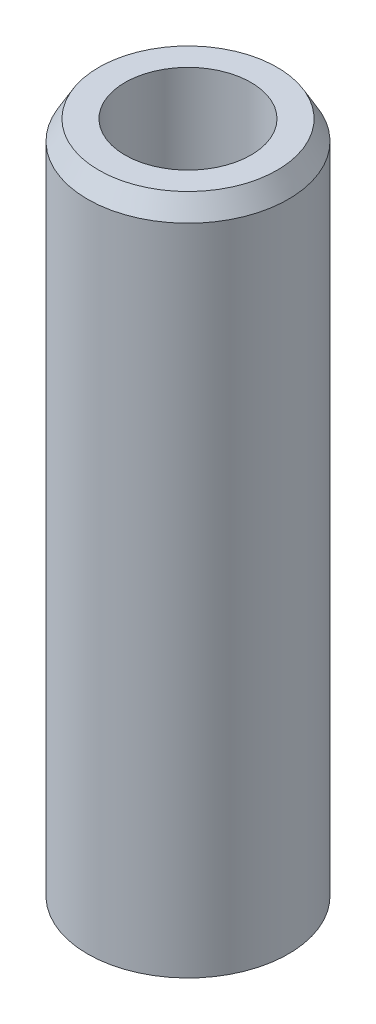
from build123d import *
from OCP.BRepFilletAPI import BRepFilletAPI_MakeChamfer

# Parameters (mm, degrees)
SKETCH1_R           = 7.5
BOSS_EXTRUDE1_DEPTH = 51.106512986
SKETCH2_R           = 4.702042441
CUT_EXTRUDE1_DEPTH  = 53.195552201
CHAMFER1_SIZE       = 1.456787229
CHAMFER1_SIZE2      = 0.841076499


with BuildPart() as part:
    # Sketch1 → Boss-Extrude1 (new body)
    with BuildSketch(Plane(origin=(0, 0, 0), x_dir=(1, 0, 0), z_dir=(0, 1, 0))):
        Circle(SKETCH1_R)
    extrude(amount=BOSS_EXTRUDE1_DEPTH)

    # Sketch2 → Cut-Extrude1 (cut, through all)
    with BuildSketch(Plane(origin=(0, 0, 0), x_dir=(1, 0, 0), z_dir=(0, 1, 0))):
        Circle(SKETCH2_R)
    extrude(amount=CUT_EXTRUDE1_DEPTH, mode=Mode.SUBTRACT)

    # Chamfer1: one chamfer whose edges measure the first distance from different faces: ONE call of the kernel's chamfer builder (chamfer() names one face for all edges)
    chamfer1_edges_1 = [part.edges().sort_by_distance(p)[0] for p in [
        (-7.5, 51.106512986, 0),
    ]]
    chamfer1_side_1 = [part.faces().sort_by_distance(p)[0] for p in [
        (-7.5, 25.553256493, 0),
    ]]
    chamfer1_edges_2 = [part.edges().sort_by_distance(p)[0] for p in [
        (-7.5, 0, 0),
    ]]
    chamfer1_side_2 = [part.faces().sort_by_distance(p)[0] for p in [
        (-7.287867966, 0, 0),
    ]]
    chamfer1 = BRepFilletAPI_MakeChamfer(part.part.solid().wrapped)
    for e in chamfer1_edges_1:
        chamfer1.Add(CHAMFER1_SIZE, CHAMFER1_SIZE2, e.wrapped, chamfer1_side_1[0].wrapped)  # the first distance lies on this face
    for e in chamfer1_edges_2:
        chamfer1.Add(CHAMFER1_SIZE, CHAMFER1_SIZE2, e.wrapped, chamfer1_side_2[0].wrapped)  # the first distance lies on this face
    add(Compound.cast(chamfer1.Shape()), mode=Mode.REPLACE)


solid = part.part
